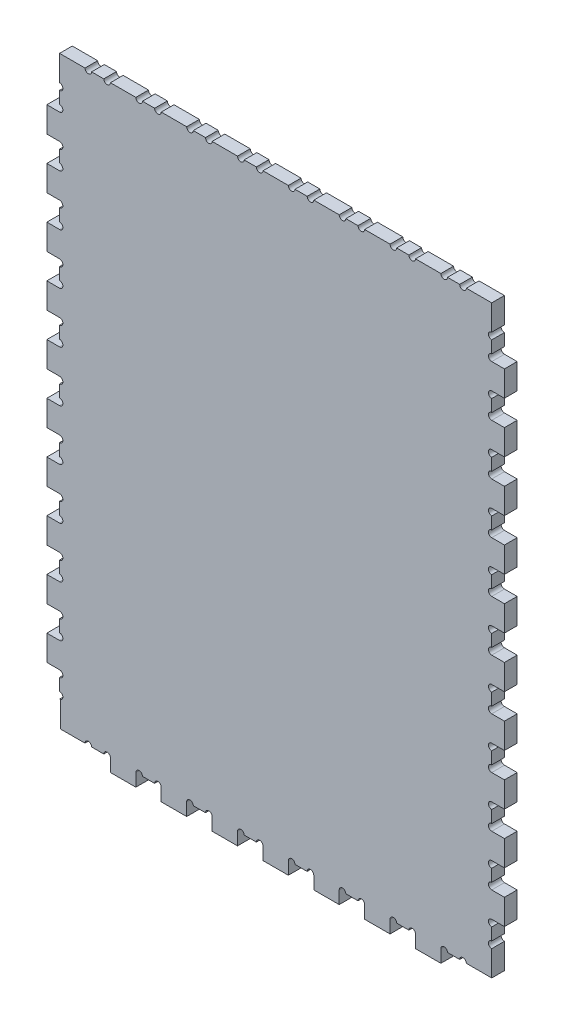
from build123d import *

# Parameters (mm, degrees)
SKETCH1_W             = 457.2
SKETCH1_H             = 609.6
BOSS_EXTRUDE1_DEPTH   = 12.7
CUT_EXTRUDE1_DEPTH    = 382.211607903
LPATTERN1_COUNT       = 8
LPATTERN1_PITCH       = 50.8
CUT_EXTRUDE2_DEPTH    = 382.211607903
LPATTERN2_COUNT       = 11
LPATTERN2_PITCH       = 50.8
MIRROR1_COPY_1_DEPTH  = 382.211607903
MIRROR1_COPY_2_DEPTH  = 382.211607903
MIRROR1_COPY_3_DEPTH  = 382.211607903
MIRROR1_COPY_4_DEPTH  = 382.211607903
MIRROR1_COPY_5_DEPTH  = 382.211607903
MIRROR1_COPY_6_DEPTH  = 382.211607903
MIRROR1_COPY_7_DEPTH  = 382.211607903
MIRROR1_COPY_8_DEPTH  = 382.211607903
MIRROR1_COPY_9_DEPTH  = 382.211607903
MIRROR1_COPY_10_DEPTH = 382.211607903
MIRROR1_COPY_11_DEPTH = 382.211607903
MIRROR2_COPY_1_DEPTH  = 382.211607903
MIRROR2_COPY_2_DEPTH  = 382.211607903
MIRROR2_COPY_3_DEPTH  = 382.211607903
MIRROR2_COPY_4_DEPTH  = 382.211607903
MIRROR2_COPY_5_DEPTH  = 382.211607903
MIRROR2_COPY_6_DEPTH  = 382.211607903
MIRROR2_COPY_7_DEPTH  = 382.211607903
MIRROR2_COPY_8_DEPTH  = 382.211607903
CUT_EXTRUDE3_DEPTH    = 382.211607903
SKETCH5_W             = 431.8
SKETCH5_H             = 12.773172403
CUT_EXTRUDE4_DEPTH    = 382.211607903


with BuildPart() as part:
    # Sketch1 → Boss-Extrude1 (new body)
    with BuildSketch(Plane.XY):
        Rectangle(SKETCH1_W, SKETCH1_H)
    extrude(amount=BOSS_EXTRUDE1_DEPTH)

    # Sketch2 → Cut-Extrude1 (cut, through all)
    with BuildSketch(Plane.XY.offset(12.7)):
        with BuildLine():
            Line((-165.1, 304.8), (-190.5, 304.8))
            Line((-190.5, 304.8), (-190.5, 292.1))
            ThreePointArc((-190.5, 292.1), (-187.198, 288.798), (-183.896, 292.1))
            Line((-183.896, 292.1), (-171.704, 292.1))
            ThreePointArc((-171.704, 292.1), (-168.402, 288.798), (-165.1, 292.1))
            Line((-165.1, 292.1), (-165.1, 304.8))
        make_face()
    cut_extrude1 = extrude(amount=-CUT_EXTRUDE1_DEPTH, mode=Mode.SUBTRACT)

    # LPattern1: Cut-Extrude1 ×8
    with Locations(*[(i * LPATTERN1_PITCH, 0, 0) for i in range(1, LPATTERN1_COUNT)]):
        add(cut_extrude1, mode=Mode.SUBTRACT)

    # Sketch3 → Cut-Extrude2 (cut, through all)
    with BuildSketch(Plane.XY.offset(12.7)):
        with BuildLine():
            Line((-215.9, 266.7), (-228.6, 266.7))
            Line((-228.6, 266.7), (-228.6, 241.3))
            Line((-228.6, 241.3), (-215.9, 241.3))
            ThreePointArc((-215.9, 241.3), (-212.598, 244.602), (-215.9, 247.904))
            Line((-215.9, 247.904), (-215.9, 260.096))
            ThreePointArc((-215.9, 260.096), (-212.598, 263.398), (-215.9, 266.7))
        make_face()
    cut_extrude2 = extrude(amount=-CUT_EXTRUDE2_DEPTH, mode=Mode.SUBTRACT)

    # LPattern2: Cut-Extrude2 ×11
    with Locations(*[(0, -i * LPATTERN2_PITCH, 0) for i in range(1, LPATTERN2_COUNT)]):
        add(cut_extrude2, mode=Mode.SUBTRACT)

    # Mirror1 copy 1 sketch → Mirror1 copy 1 (cut, through all)
    with BuildSketch(Plane(origin=(0, -50.8, 12.7), x_dir=(-1, 0, 0), z_dir=(0, 0, 1))):
        with BuildLine():
            Line((-215.9, -266.7), (-228.6, -266.7))
            Line((-228.6, -266.7), (-228.6, -241.3))
            Line((-228.6, -241.3), (-215.9, -241.3))
            ThreePointArc((-215.9, -241.3), (-212.598, -244.602), (-215.9, -247.904))
            Line((-215.9, -247.904), (-215.9, -260.096))
            ThreePointArc((-215.9, -260.096), (-212.598, -263.398), (-215.9, -266.7))
        make_face()
    extrude(amount=-MIRROR1_COPY_1_DEPTH, mode=Mode.SUBTRACT)

    # Mirror1 copy 2 sketch → Mirror1 copy 2 (cut, through all)
    with BuildSketch(Plane(origin=(0, -101.6, 12.7), x_dir=(-1, 0, 0), z_dir=(0, 0, 1))):
        with BuildLine():
            Line((-215.9, -266.7), (-228.6, -266.7))
            Line((-228.6, -266.7), (-228.6, -241.3))
            Line((-228.6, -241.3), (-215.9, -241.3))
            ThreePointArc((-215.9, -241.3), (-212.598, -244.602), (-215.9, -247.904))
            Line((-215.9, -247.904), (-215.9, -260.096))
            ThreePointArc((-215.9, -260.096), (-212.598, -263.398), (-215.9, -266.7))
        make_face()
    extrude(amount=-MIRROR1_COPY_2_DEPTH, mode=Mode.SUBTRACT)

    # Mirror1 copy 3 sketch → Mirror1 copy 3 (cut, through all)
    with BuildSketch(Plane(origin=(0, -152.4, 12.7), x_dir=(-1, 0, 0), z_dir=(0, 0, 1))):
        with BuildLine():
            Line((-215.9, -266.7), (-228.6, -266.7))
            Line((-228.6, -266.7), (-228.6, -241.3))
            Line((-228.6, -241.3), (-215.9, -241.3))
            ThreePointArc((-215.9, -241.3), (-212.598, -244.602), (-215.9, -247.904))
            Line((-215.9, -247.904), (-215.9, -260.096))
            ThreePointArc((-215.9, -260.096), (-212.598, -263.398), (-215.9, -266.7))
        make_face()
    extrude(amount=-MIRROR1_COPY_3_DEPTH, mode=Mode.SUBTRACT)

    # Mirror1 copy 4 sketch → Mirror1 copy 4 (cut, through all)
    with BuildSketch(Plane(origin=(0, -203.2, 12.7), x_dir=(-1, 0, 0), z_dir=(0, 0, 1))):
        with BuildLine():
            Line((-215.9, -266.7), (-228.6, -266.7))
            Line((-228.6, -266.7), (-228.6, -241.3))
            Line((-228.6, -241.3), (-215.9, -241.3))
            ThreePointArc((-215.9, -241.3), (-212.598, -244.602), (-215.9, -247.904))
            Line((-215.9, -247.904), (-215.9, -260.096))
            ThreePointArc((-215.9, -260.096), (-212.598, -263.398), (-215.9, -266.7))
        make_face()
    extrude(amount=-MIRROR1_COPY_4_DEPTH, mode=Mode.SUBTRACT)

    # Mirror1 copy 5 sketch → Mirror1 copy 5 (cut, through all)
    with BuildSketch(Plane(origin=(0, -254, 12.7), x_dir=(-1, 0, 0), z_dir=(0, 0, 1))):
        with BuildLine():
            Line((-215.9, -266.7), (-228.6, -266.7))
            Line((-228.6, -266.7), (-228.6, -241.3))
            Line((-228.6, -241.3), (-215.9, -241.3))
            ThreePointArc((-215.9, -241.3), (-212.598, -244.602), (-215.9, -247.904))
            Line((-215.9, -247.904), (-215.9, -260.096))
            ThreePointArc((-215.9, -260.096), (-212.598, -263.398), (-215.9, -266.7))
        make_face()
    extrude(amount=-MIRROR1_COPY_5_DEPTH, mode=Mode.SUBTRACT)

    # Mirror1 copy 6 sketch → Mirror1 copy 6 (cut, through all)
    with BuildSketch(Plane(origin=(0, -304.8, 12.7), x_dir=(-1, 0, 0), z_dir=(0, 0, 1))):
        with BuildLine():
            Line((-215.9, -266.7), (-228.6, -266.7))
            Line((-228.6, -266.7), (-228.6, -241.3))
            Line((-228.6, -241.3), (-215.9, -241.3))
            ThreePointArc((-215.9, -241.3), (-212.598, -244.602), (-215.9, -247.904))
            Line((-215.9, -247.904), (-215.9, -260.096))
            ThreePointArc((-215.9, -260.096), (-212.598, -263.398), (-215.9, -266.7))
        make_face()
    extrude(amount=-MIRROR1_COPY_6_DEPTH, mode=Mode.SUBTRACT)

    # Mirror1 copy 7 sketch → Mirror1 copy 7 (cut, through all)
    with BuildSketch(Plane(origin=(0, -355.6, 12.7), x_dir=(-1, 0, 0), z_dir=(0, 0, 1))):
        with BuildLine():
            Line((-215.9, -266.7), (-228.6, -266.7))
            Line((-228.6, -266.7), (-228.6, -241.3))
            Line((-228.6, -241.3), (-215.9, -241.3))
            ThreePointArc((-215.9, -241.3), (-212.598, -244.602), (-215.9, -247.904))
            Line((-215.9, -247.904), (-215.9, -260.096))
            ThreePointArc((-215.9, -260.096), (-212.598, -263.398), (-215.9, -266.7))
        make_face()
    extrude(amount=-MIRROR1_COPY_7_DEPTH, mode=Mode.SUBTRACT)

    # Mirror1 copy 8 sketch → Mirror1 copy 8 (cut, through all)
    with BuildSketch(Plane(origin=(0, -406.4, 12.7), x_dir=(-1, 0, 0), z_dir=(0, 0, 1))):
        with BuildLine():
            Line((-215.9, -266.7), (-228.6, -266.7))
            Line((-228.6, -266.7), (-228.6, -241.3))
            Line((-228.6, -241.3), (-215.9, -241.3))
            ThreePointArc((-215.9, -241.3), (-212.598, -244.602), (-215.9, -247.904))
            Line((-215.9, -247.904), (-215.9, -260.096))
            ThreePointArc((-215.9, -260.096), (-212.598, -263.398), (-215.9, -266.7))
        make_face()
    extrude(amount=-MIRROR1_COPY_8_DEPTH, mode=Mode.SUBTRACT)

    # Mirror1 copy 9 sketch → Mirror1 copy 9 (cut, through all)
    with BuildSketch(Plane(origin=(0, -457.2, 12.7), x_dir=(-1, 0, 0), z_dir=(0, 0, 1))):
        with BuildLine():
            Line((-215.9, -266.7), (-228.6, -266.7))
            Line((-228.6, -266.7), (-228.6, -241.3))
            Line((-228.6, -241.3), (-215.9, -241.3))
            ThreePointArc((-215.9, -241.3), (-212.598, -244.602), (-215.9, -247.904))
            Line((-215.9, -247.904), (-215.9, -260.096))
            ThreePointArc((-215.9, -260.096), (-212.598, -263.398), (-215.9, -266.7))
        make_face()
    extrude(amount=-MIRROR1_COPY_9_DEPTH, mode=Mode.SUBTRACT)

    # Mirror1 copy 10 sketch → Mirror1 copy 10 (cut, through all)
    with BuildSketch(Plane(origin=(0, -508, 12.7), x_dir=(-1, 0, 0), z_dir=(0, 0, 1))):
        with BuildLine():
            Line((-215.9, -266.7), (-228.6, -266.7))
            Line((-228.6, -266.7), (-228.6, -241.3))
            Line((-228.6, -241.3), (-215.9, -241.3))
            ThreePointArc((-215.9, -241.3), (-212.598, -244.602), (-215.9, -247.904))
            Line((-215.9, -247.904), (-215.9, -260.096))
            ThreePointArc((-215.9, -260.096), (-212.598, -263.398), (-215.9, -266.7))
        make_face()
    extrude(amount=-MIRROR1_COPY_10_DEPTH, mode=Mode.SUBTRACT)

    # Mirror1 copy 11 sketch → Mirror1 copy 11 (cut, through all)
    with BuildSketch(Plane(origin=(0, 0, 12.7), x_dir=(-1, 0, 0), z_dir=(0, 0, 1))):
        with BuildLine():
            Line((-215.9, -266.7), (-228.6, -266.7))
            Line((-228.6, -266.7), (-228.6, -241.3))
            Line((-228.6, -241.3), (-215.9, -241.3))
            ThreePointArc((-215.9, -241.3), (-212.598, -244.602), (-215.9, -247.904))
            Line((-215.9, -247.904), (-215.9, -260.096))
            ThreePointArc((-215.9, -260.096), (-212.598, -263.398), (-215.9, -266.7))
        make_face()
    extrude(amount=-MIRROR1_COPY_11_DEPTH, mode=Mode.SUBTRACT)

    # Mirror2 copy 1 sketch → Mirror2 copy 1 (cut, through all)
    with BuildSketch(Plane(origin=(50.8, 0, 12.7), x_dir=(1, 0, 0), z_dir=(0, 0, 1))):
        with BuildLine():
            Line((-165.1, -304.8), (-190.5, -304.8))
            Line((-190.5, -304.8), (-190.5, -292.1))
            ThreePointArc((-190.5, -292.1), (-187.198, -288.798), (-183.896, -292.1))
            Line((-183.896, -292.1), (-171.704, -292.1))
            ThreePointArc((-171.704, -292.1), (-168.402, -288.798), (-165.1, -292.1))
            Line((-165.1, -292.1), (-165.1, -304.8))
        make_face()
    extrude(amount=-MIRROR2_COPY_1_DEPTH, mode=Mode.SUBTRACT)

    # Mirror2 copy 2 sketch → Mirror2 copy 2 (cut, through all)
    with BuildSketch(Plane(origin=(101.6, 0, 12.7), x_dir=(1, 0, 0), z_dir=(0, 0, 1))):
        with BuildLine():
            Line((-165.1, -304.8), (-190.5, -304.8))
            Line((-190.5, -304.8), (-190.5, -292.1))
            ThreePointArc((-190.5, -292.1), (-187.198, -288.798), (-183.896, -292.1))
            Line((-183.896, -292.1), (-171.704, -292.1))
            ThreePointArc((-171.704, -292.1), (-168.402, -288.798), (-165.1, -292.1))
            Line((-165.1, -292.1), (-165.1, -304.8))
        make_face()
    extrude(amount=-MIRROR2_COPY_2_DEPTH, mode=Mode.SUBTRACT)

    # Mirror2 copy 3 sketch → Mirror2 copy 3 (cut, through all)
    with BuildSketch(Plane(origin=(152.4, 0, 12.7), x_dir=(1, 0, 0), z_dir=(0, 0, 1))):
        with BuildLine():
            Line((-165.1, -304.8), (-190.5, -304.8))
            Line((-190.5, -304.8), (-190.5, -292.1))
            ThreePointArc((-190.5, -292.1), (-187.198, -288.798), (-183.896, -292.1))
            Line((-183.896, -292.1), (-171.704, -292.1))
            ThreePointArc((-171.704, -292.1), (-168.402, -288.798), (-165.1, -292.1))
            Line((-165.1, -292.1), (-165.1, -304.8))
        make_face()
    extrude(amount=-MIRROR2_COPY_3_DEPTH, mode=Mode.SUBTRACT)

    # Mirror2 copy 4 sketch → Mirror2 copy 4 (cut, through all)
    with BuildSketch(Plane(origin=(203.2, 0, 12.7), x_dir=(1, 0, 0), z_dir=(0, 0, 1))):
        with BuildLine():
            Line((-165.1, -304.8), (-190.5, -304.8))
            Line((-190.5, -304.8), (-190.5, -292.1))
            ThreePointArc((-190.5, -292.1), (-187.198, -288.798), (-183.896, -292.1))
            Line((-183.896, -292.1), (-171.704, -292.1))
            ThreePointArc((-171.704, -292.1), (-168.402, -288.798), (-165.1, -292.1))
            Line((-165.1, -292.1), (-165.1, -304.8))
        make_face()
    extrude(amount=-MIRROR2_COPY_4_DEPTH, mode=Mode.SUBTRACT)

    # Mirror2 copy 5 sketch → Mirror2 copy 5 (cut, through all)
    with BuildSketch(Plane(origin=(254, 0, 12.7), x_dir=(1, 0, 0), z_dir=(0, 0, 1))):
        with BuildLine():
            Line((-165.1, -304.8), (-190.5, -304.8))
            Line((-190.5, -304.8), (-190.5, -292.1))
            ThreePointArc((-190.5, -292.1), (-187.198, -288.798), (-183.896, -292.1))
            Line((-183.896, -292.1), (-171.704, -292.1))
            ThreePointArc((-171.704, -292.1), (-168.402, -288.798), (-165.1, -292.1))
            Line((-165.1, -292.1), (-165.1, -304.8))
        make_face()
    extrude(amount=-MIRROR2_COPY_5_DEPTH, mode=Mode.SUBTRACT)

    # Mirror2 copy 6 sketch → Mirror2 copy 6 (cut, through all)
    with BuildSketch(Plane(origin=(304.8, 0, 12.7), x_dir=(1, 0, 0), z_dir=(0, 0, 1))):
        with BuildLine():
            Line((-165.1, -304.8), (-190.5, -304.8))
            Line((-190.5, -304.8), (-190.5, -292.1))
            ThreePointArc((-190.5, -292.1), (-187.198, -288.798), (-183.896, -292.1))
            Line((-183.896, -292.1), (-171.704, -292.1))
            ThreePointArc((-171.704, -292.1), (-168.402, -288.798), (-165.1, -292.1))
            Line((-165.1, -292.1), (-165.1, -304.8))
        make_face()
    extrude(amount=-MIRROR2_COPY_6_DEPTH, mode=Mode.SUBTRACT)

    # Mirror2 copy 7 sketch → Mirror2 copy 7 (cut, through all)
    with BuildSketch(Plane(origin=(355.6, 0, 12.7), x_dir=(1, 0, 0), z_dir=(0, 0, 1))):
        with BuildLine():
            Line((-165.1, -304.8), (-190.5, -304.8))
            Line((-190.5, -304.8), (-190.5, -292.1))
            ThreePointArc((-190.5, -292.1), (-187.198, -288.798), (-183.896, -292.1))
            Line((-183.896, -292.1), (-171.704, -292.1))
            ThreePointArc((-171.704, -292.1), (-168.402, -288.798), (-165.1, -292.1))
            Line((-165.1, -292.1), (-165.1, -304.8))
        make_face()
    extrude(amount=-MIRROR2_COPY_7_DEPTH, mode=Mode.SUBTRACT)

    # Mirror2 copy 8 sketch → Mirror2 copy 8 (cut, through all)
    with BuildSketch(Plane.XY.offset(12.7)):
        with BuildLine():
            Line((-165.1, -304.8), (-190.5, -304.8))
            Line((-190.5, -304.8), (-190.5, -292.1))
            ThreePointArc((-190.5, -292.1), (-187.198, -288.798), (-183.896, -292.1))
            Line((-183.896, -292.1), (-171.704, -292.1))
            ThreePointArc((-171.704, -292.1), (-168.402, -288.798), (-165.1, -292.1))
            Line((-165.1, -292.1), (-165.1, -304.8))
        make_face()
    extrude(amount=-MIRROR2_COPY_8_DEPTH, mode=Mode.SUBTRACT)

    # Sketch4 → Cut-Extrude3 (cut, through all)
    with BuildSketch(Plane.XY.offset(12.7)):
        Polygon((-228.6, 304.8), (-228.6, 266.7), (-215.9, 266.7), (-215.9, 292.1), (-190.5, 292.1), (-190.5, 304.8), align=None)
        Polygon((-228.6, -266.7), (-228.6, -304.8), (-190.5, -304.8), (-190.5, -292.1), (-214.752188901, -292.1), (-214.752188901, -266.7), align=None)
        Polygon((190.5, -304.8), (228.6, -304.8), (228.6, -266.7), (215.9, -266.7), (215.9, -292.1), (190.5, -292.1), align=None)
        Polygon((228.6, 304.8), (190.5, 304.8), (190.5, 292.1), (215.9, 292.1), (215.9, 266.7), (228.6, 266.7), align=None)
    extrude(amount=-CUT_EXTRUDE3_DEPTH, mode=Mode.SUBTRACT)

    # Sketch5 → Cut-Extrude4 (cut, through all)
    with BuildSketch(Plane.XY.offset(12.7)):
        with Locations((0, 298.486586202)):
            Rectangle(SKETCH5_W, SKETCH5_H)
    extrude(amount=-CUT_EXTRUDE4_DEPTH, mode=Mode.SUBTRACT)


solid = part.part
